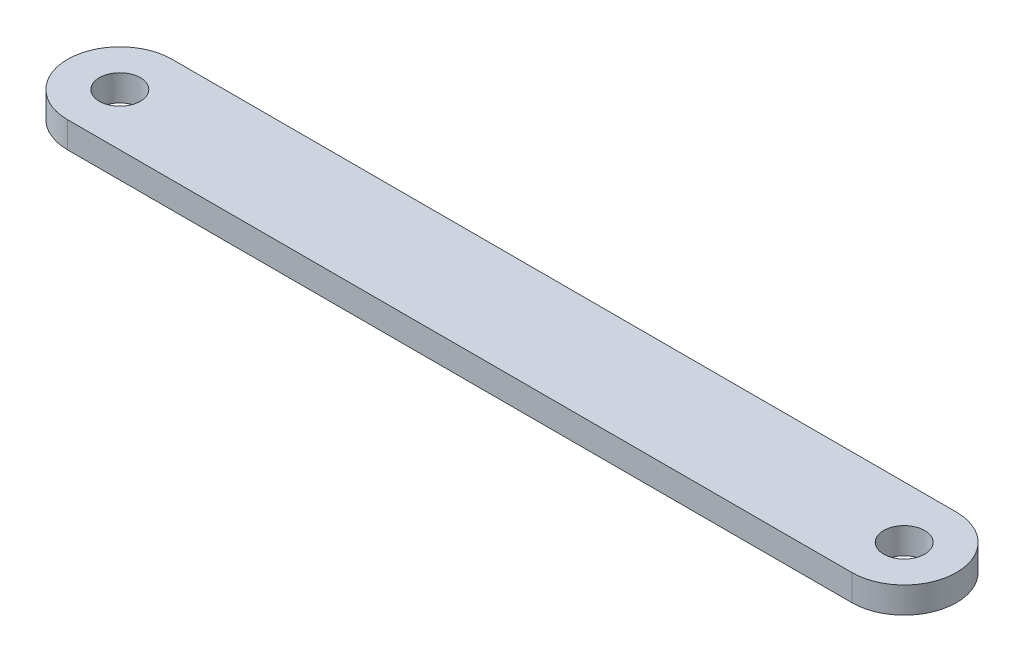
from build123d import *

# Parameters (mm, degrees)
BOSS_EXTRUDE1_DEPTH    = 3.175
F_10_CLEARANCE_HOLE1_D = 4.9784


with BuildPart() as part:
    # Sketch1 → Boss-Extrude1 (new body)
    with BuildSketch(Plane(origin=(0, 0, 0), x_dir=(1, 0, 0), z_dir=(0, 1, 0))):
        with BuildLine():
            Line((-47.625, 6.35), (47.625, 6.35))
            ThreePointArc((47.625, 6.35), (53.975, 0), (47.625, -6.35))
            Line((47.625, -6.35), (-47.625, -6.35))
            ThreePointArc((-47.625, -6.35), (-53.975, 0), (-47.625, 6.35))
        make_face()
    extrude(amount=BOSS_EXTRUDE1_DEPTH)

    # #10 Clearance Hole1 (through all)
    with Locations(Plane(origin=(0, 3.175, 0), x_dir=(1, 0, 0), z_dir=(0, 1, 0))):
        with Locations((-47.625, 0), (47.625, 0)):
            Hole(F_10_CLEARANCE_HOLE1_D / 2)


solid = part.part
